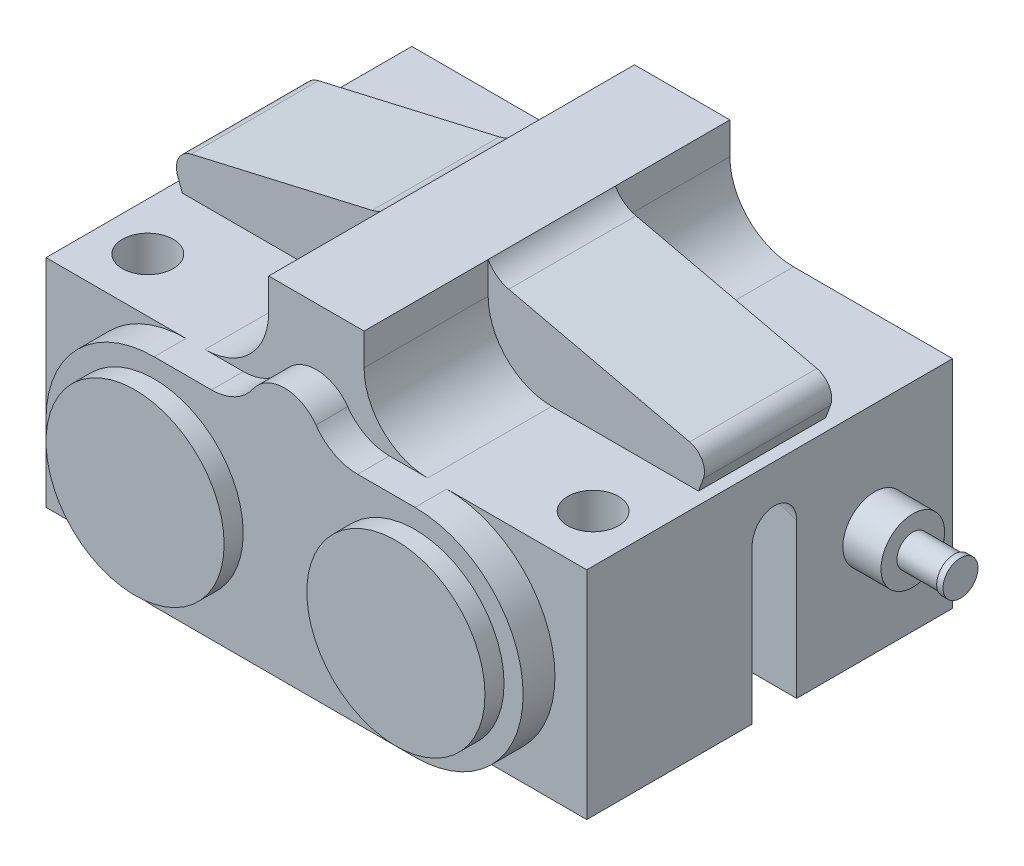
from build123d import *

# Parameters (mm, degrees)
BOSS_EXTRUDE1_DEPTH      = 37.5
BOSS_EXTRUDE1_DEPTH_BACK = 28
CUT_EXTRUDE2_START       = -28
CUT_EXTRUDE2_DEPTH       = 18
CUT_EXTRUDE3_START       = 10
CUT_EXTRUDE3_DEPTH       = 27.5
SKETCH6_OUTSIDE_W        = 110.594
SKETCH6_OUTSIDE_H        = 74.594
CUT_EXTRUDE4_DEPTH       = 8
SKETCH7_OUTSIDE_W        = 110.594
SKETCH7_OUTSIDE_H        = 74.594
SKETCH7_OUTSIDE_R        = 14
CUT_EXTRUDE5_DEPTH       = 3


# Read off the part's stored shape, not the designer's step: Cut-Extrude2, Cut-Extrude3
with BuildPart() as part:
    # Sketch1 → Boss-Extrude1 (new, two sides: drawn at the far end of the back side and taken through both)
    with BuildSketch(Plane.XY.offset(-BOSS_EXTRUDE1_DEPTH_BACK)):
        with BuildLine():
            Line((-42.5, 2.3), (-40.572637014, 2.3))
            Line((-40.572637014, 2.3), (-41.319077862, 4.350829376))
            ThreePointArc((-41.319077862, 4.350829376), (-41.136451338, 6.808366086), (-39.174853163, 8.3))
            Line((-39.174853163, 8.3), (-10.741593286, 14.864335276))
            ThreePointArc((-10.741593286, 14.864335276), (-8.862822134, 15.738832848), (-7.5, 17.3))
            Line((-7.5, 17.3), (7.5, 17.3))
            ThreePointArc((7.5, 17.3), (8.862822134, 15.738832848), (10.741593286, 14.864335276))
            Line((10.741593286, 14.864335276), (39.174853163, 8.3))
            ThreePointArc((39.174853163, 8.3), (41.136451338, 6.808366086), (41.319077862, 4.350829376))
            Line((41.319077862, 4.350829376), (40.572637014, 2.3))
            Line((40.572637014, 2.3), (42.5, 2.3))
            Line((42.5, 2.3), (42.5, -31.7))
            Line((42.5, -31.7), (-42.5, -31.7))
            Line((-42.5, -31.7), (-42.5, 2.3))
        make_face()
    extrude(amount=BOSS_EXTRUDE1_DEPTH + BOSS_EXTRUDE1_DEPTH_BACK)

    # Sketch2 → Cut-Revolve1 (revolve, cut)
    with BuildSketch(Plane(origin=(0, 0, 0), x_dir=(0, 0, -1), z_dir=(1, 0, 0))):
        with BuildLine():
            Line((-3.5, -125), (-3.5, 0))
            ThreePointArc((-3.5, 0), (0, 3.5), (3.5, 0))
            Line((3.5, 0), (3.5, -125))
            Line((3.5, -125), (-3.5, -125))
        make_face()
    revolve(axis=Axis((0, -125, 37.5), (0, 0, -1)), mode=Mode.SUBTRACT)

    # Cut-Extrude2 outline → Cut-Extrude2 (cut)
    with BuildSketch(Plane.XY.offset(CUT_EXTRUDE2_START)):
        with BuildLine():
            ThreePointArc((7.5, 12.3), (10.428932188, 5.228932188), (17.5, 2.3))
            Line((17.5, 2.3), (40.572637014, 2.3))
            Line((40.572637014, 2.3), (41.319077862, 4.350829376))
            ThreePointArc((41.319077862, 4.350829376), (41.136451338, 6.808366087), (39.174853163, 8.3))
            Line((39.174853163, 8.3), (10.741593286, 14.864335276))
            ThreePointArc((10.741593286, 14.864335276), (8.862822134, 15.738832848), (7.5, 17.3))
            Line((7.5, 17.3), (7.5, 12.3))
        make_face()
        with BuildLine():
            Line((-41.319077862, 4.350829376), (-40.572637014, 2.3))
            Line((-40.572637014, 2.3), (-17.5, 2.3))
            ThreePointArc((-17.5, 2.3), (-10.428932188, 5.228932188), (-7.5, 12.3))
            Line((-7.5, 12.3), (-7.5, 17.3))
            ThreePointArc((-7.5, 17.3), (-8.862822134, 15.738832848), (-10.741593286, 14.864335276))
            Line((-10.741593286, 14.864335276), (-39.174853163, 8.3))
            ThreePointArc((-39.174853163, 8.3), (-41.136451338, 6.808366087), (-41.319077862, 4.350829376))
        make_face()
    extrude(amount=CUT_EXTRUDE2_DEPTH, mode=Mode.SUBTRACT)

    # Cut-Extrude3 outline → Cut-Extrude3 (cut)
    with BuildSketch(Plane.XY.offset(CUT_EXTRUDE3_START)):
        with BuildLine():
            ThreePointArc((7.5, 12.3), (10.428932188, 5.228932188), (17.5, 2.3))
            Line((17.5, 2.3), (40.572637014, 2.3))
            Line((40.572637014, 2.3), (41.319077862, 4.350829376))
            ThreePointArc((41.319077862, 4.350829376), (41.136451338, 6.808366087), (39.174853163, 8.3))
            Line((39.174853163, 8.3), (10.741593286, 14.864335276))
            ThreePointArc((10.741593286, 14.864335276), (8.862822134, 15.738832848), (7.5, 17.3))
            Line((7.5, 17.3), (7.5, 12.3))
        make_face()
        with BuildLine():
            Line((-41.319077862, 4.350829376), (-40.572637014, 2.3))
            Line((-40.572637014, 2.3), (-17.5, 2.3))
            ThreePointArc((-17.5, 2.3), (-10.428932188, 5.228932188), (-7.5, 12.3))
            Line((-7.5, 12.3), (-7.5, 17.3))
            ThreePointArc((-7.5, 17.3), (-8.862822134, 15.738832848), (-10.741593286, 14.864335276))
            Line((-10.741593286, 14.864335276), (-39.174853163, 8.3))
            ThreePointArc((-39.174853163, 8.3), (-41.136451338, 6.808366087), (-41.319077862, 4.350829376))
        make_face()
    extrude(amount=CUT_EXTRUDE3_DEPTH, mode=Mode.SUBTRACT)

    # Sketch5 → Cut-Revolve2 (revolve, cut)
    with BuildSketch(Plane.XY.offset(21), mode=Mode.PRIVATE) as cut_revolve2_sk:
        Polygon((-35, -31.7), (-40, -31.7), (-40, -28.7), (-39, -28.7), (-39, 17.3), (-35, 17.3), align=None)
    cut_revolve2 = revolve(cut_revolve2_sk.sketch.rotate(Axis((-35, -31.7, 21), (0, 1, 0)), 270), axis=Axis((-35, -31.7, 21), (0, 1, 0)), mode=Mode.SUBTRACT)

    # Mirror1: Cut-Revolve2 across plane
    add(cut_revolve2.mirror(Plane(origin=(0, 0, 0), x_dir=(0, 0, 1), z_dir=(1, 0, 0))), mode=Mode.SUBTRACT)

    # Sketch6 outside → Cut-Extrude4 (cut)
    with BuildSketch(Plane.XY.offset(37.5)):
        with Locations((0, -7.2)):
            Rectangle(SKETCH6_OUTSIDE_W, SKETCH6_OUTSIDE_H)
        with BuildLine():
            Line((20.5, 2.3), (11.489125293, 2.3))
            ThreePointArc((11.489125293, 2.3), (7.785844894, 3.208757917), (4.92391084, 5.728571429))
            ThreePointArc((4.92391084, 5.728571429), (0, 8.3), (-4.92391084, 5.728571429))
            ThreePointArc((-4.92391084, 5.728571429), (-7.785844894, 3.208757917), (-11.489125293, 2.3))
            Line((-11.489125293, 2.3), (-20.5, 2.3))
            ThreePointArc((-20.5, 2.3), (-37.5, -14.7), (-20.5, -31.7))
            Line((-20.5, -31.7), (20.5, -31.7))
            ThreePointArc((20.5, -31.7), (37.5, -14.7), (20.5, 2.3))
        make_face(mode=Mode.SUBTRACT)
    extrude(amount=-CUT_EXTRUDE4_DEPTH, mode=Mode.SUBTRACT)

    # Sketch7 outside → Cut-Extrude5 (cut)
    with BuildSketch(Plane.XY.offset(37.5)):
        with Locations((0, -7.2)):
            Rectangle(SKETCH7_OUTSIDE_W, SKETCH7_OUTSIDE_H)
        with Locations((-20.5, -14.7)):
            Circle(SKETCH7_OUTSIDE_R, mode=Mode.SUBTRACT)
        with Locations((20.5, -14.7)):
            Circle(SKETCH7_OUTSIDE_R, mode=Mode.SUBTRACT)
    extrude(amount=-CUT_EXTRUDE5_DEPTH, mode=Mode.SUBTRACT)

    # Sketch8 → Revolve1 (revolve)
    with BuildSketch(Plane.XY.offset(-15.75)):
        Polygon((-56, -14.7), (-56, -17.45), (-55, -17.45), (-55, -17.2), (-48.5, -17.2), (-48.5, -19.7), (-42.5, -19.7), (-42.5, -14.7), align=None)
        Polygon((42.5, -19.7), (42.5, -14.7), (56, -14.7), (56, -17.45), (55, -17.45), (55, -17.2), (48.5, -17.2), (48.5, -19.7), align=None)
    revolve(axis=Axis((-56, -14.7, -15.75), (1, 0, 0)))


solid = part.part
